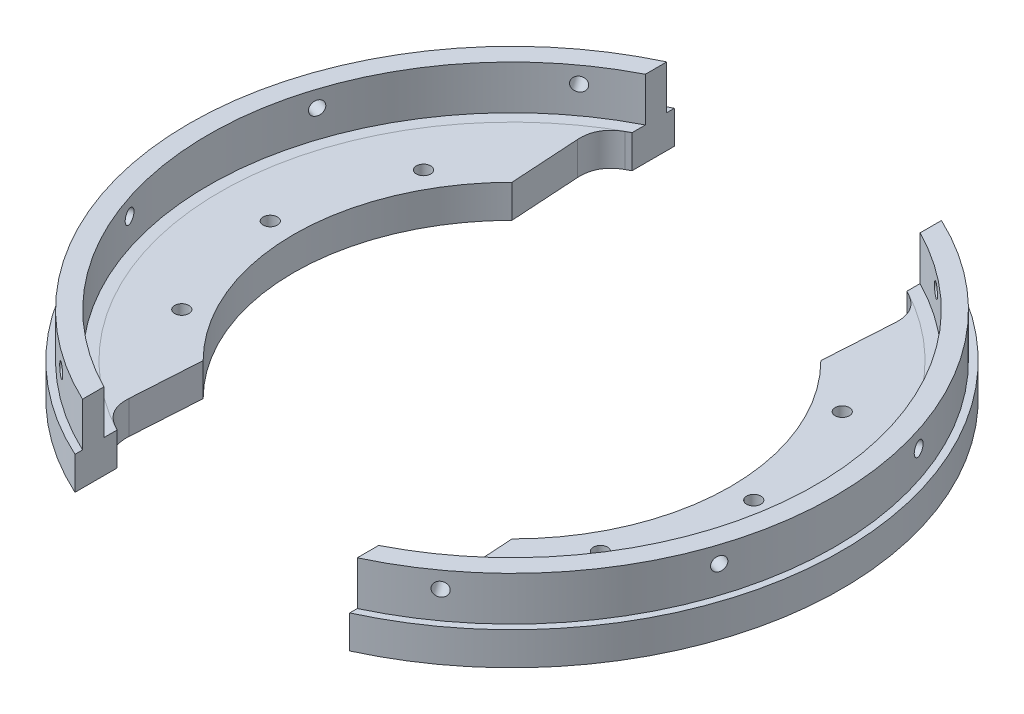
from build123d import *

# Parameters (mm, degrees)
SKETCH1_R               = 152.4
SKETCH1_R_2             = 100.965
BOSS_EXTRUDE1_DEPTH     = 15.24
SKETCH4_R               = 149.225
SKETCH4_R_2             = 140.335
BOSS_EXTRUDE3_DEPTH     = 20.32
CUT_EXTRUDE5_DEPTH      = 15.24
CIRPATTERN1_COUNT       = 2
SKETCH31_R              = 3.302
CUT_EXTRUDE6_DEPTH      = 217.481921647
CIRPATTERN2_COUNT       = 12
CUT_EXTRUDE7_REACH      = 341.806
CUT_EXTRUDE7_END_RADIUS = 140.335
SKETCH34_R              = 3.175
CIRPATTERN3_COUNT       = 10
SKETCH37_W              = 127
SKETCH37_H              = 40.478806784
CUT_EXTRUDE8_DEPTH      = 343.627076715


with BuildPart() as part:
    # Sketch1 → Boss-Extrude1 (new body)
    with BuildSketch(Plane(origin=(0, 0, 0), x_dir=(1, 0, 0), z_dir=(0, 1, 0))):
        with Locations(Location((0, 0, 0), (0, 0, 90))):
            Circle(SKETCH1_R)
        with Locations(Location((0, 0, 0), (0, 0, 90))):
            Circle(SKETCH1_R_2, mode=Mode.SUBTRACT)
    extrude(amount=BOSS_EXTRUDE1_DEPTH)

    # Sketch4 → Boss-Extrude3 (add)
    with BuildSketch(Plane(origin=(0, 15.24, 0), x_dir=(1, 0, 0), z_dir=(0, 1, 0))):
        with Locations(Location((0, 0, 0), (0, 0, 270))):
            Circle(SKETCH4_R)
        with Locations(Location((0, 0, 0), (0, 0, 270))):
            Circle(SKETCH4_R_2, mode=Mode.SUBTRACT)
    extrude(amount=BOSS_EXTRUDE3_DEPTH)

    # Sketch27 → Cut-Extrude5 (cut)
    with BuildSketch(Plane(origin=(0, 0, 0), x_dir=(1, 0, 0), z_dir=(0, 1, 0))):
        with BuildLine():
            ThreePointArc((-71.393036162, 71.393036162), (0, 100.965), (71.393036162, 71.393036162))
            Line((71.393036162, 71.393036162), (73.941810795, 112.804753064))
            ThreePointArc((73.941810795, 112.804753064), (0, 134.878848221), (-73.941810795, 112.804753064))
            Line((-73.941810795, 112.804753064), (-71.393036162, 71.393036162))
        make_face()
    cut_extrude5 = extrude(amount=CUT_EXTRUDE5_DEPTH, mode=Mode.SUBTRACT)

    # CirPattern1: Cut-Extrude5 ×2 about axis
    cirpattern1_axis = Axis((0, 0, 0), (0, 1, 0))
    for i in range(1, CIRPATTERN1_COUNT):
        add(cut_extrude5.rotate(cirpattern1_axis, i * 360 / CIRPATTERN1_COUNT), mode=Mode.SUBTRACT)

    # Sketch31 → Cut-Extrude6 (cut, through all)
    with BuildSketch(Plane(origin=(0, 15.24, 0), x_dir=(1, 0, 0), z_dir=(0, 1, 0))):
        with Locations(Location((-111.76, 0, 0), (0, 0, 270))):
            Circle(SKETCH31_R)
    cut_extrude6 = extrude(amount=-CUT_EXTRUDE6_DEPTH, mode=Mode.SUBTRACT)

    # CirPattern2: Cut-Extrude6 ×12 about axis
    cirpattern2_axis = Axis((0, 0, 0), (0, 1, 0))
    for i in range(1, CIRPATTERN2_COUNT):
        add(cut_extrude6.rotate(cirpattern2_axis, i * 360 / CIRPATTERN2_COUNT), mode=Mode.SUBTRACT)

    # Cut-Extrude7: up to this cylinder (the profile starts outside it)
    cut_extrude7_end = Plane(origin=(0, 27.94, 0), z_dir=(0, -1, 0)) * Cylinder(CUT_EXTRUDE7_END_RADIUS, 965.282, mode=Mode.PRIVATE)
    # Sketch34 → Cut-Extrude7 (cut, up to the surface)
    with BuildSketch(Plane(origin=(0, 0, -149.225), x_dir=(-1, 0, 0), z_dir=(0, 0, -1)), mode=Mode.PRIVATE) as cut_extrude7_sk1:
        with Locations((0, 27.94)):
            Circle(SKETCH34_R)
    cut_extrude7_tool1 = extrude(cut_extrude7_sk1.sketch, amount=-CUT_EXTRUDE7_REACH, mode=Mode.PRIVATE) - cut_extrude7_end
    cut_extrude7 = cut_extrude7_tool1.solids().sort_by_distance((0, 27.94, -149.225))[0]
    add(cut_extrude7, mode=Mode.SUBTRACT)

    # CirPattern3: Cut-Extrude7 ×10 about axis
    cirpattern3_axis = Axis((0, 37.338, 0), (0, -1, 0))
    for i in range(1, CIRPATTERN3_COUNT):
        add(cut_extrude7.rotate(cirpattern3_axis, i * 360 / CIRPATTERN3_COUNT), mode=Mode.SUBTRACT)

    # Fillet8
    # a fillet whose section is not a circle: 15.24 mm, written as the material it adds along each edge
    with BuildSketch(Plane(origin=(-73.941810795, 0, -112.804753064), x_dir=(0.8556652721365351, 0, -0.5175296533141934), z_dir=(0, 1, 0))) as fillet8_piece_1:
        with BuildLine():
            Bezier((9.779269822, 0), (0.182347878, 0.348136944), (-4.273436554, -8.158806998), weights=[1, 1, 1])
            Line((-4.273436554, -8.158806998), (0, 0))
            ThreePointArc((0, 0), (4.889634911, 0.088658786), (9.779269822, 0))
        make_face()
    extrude(amount=15.24)
    with BuildSketch(Plane(origin=(-73.941810795, 0, 112.804753064), x_dir=(0.8556652721365348, 0, 0.5175296533141941), z_dir=(0, 1, 0))) as fillet8_piece_2:
        with BuildLine():
            Bezier((9.779269822, 0), (0.182347878, -0.348136944), (-4.273436554, 8.158806998), weights=[1, 1, 1])
            Line((-4.273436554, 8.158806998), (0, 0))
            ThreePointArc((0, 0), (4.889634911, -0.088658786), (9.779269822, 0))
        make_face()
    extrude(amount=15.24)
    with BuildSketch(Plane(origin=(73.941810795, 0, 112.804753064), x_dir=(-0.061430943800239474, 0, -0.9981113360461406), z_dir=(0, 1, 0))) as fillet8_piece_3:
        with BuildLine():
            Bezier((9.210232984, 0), (-0.393001374, 0), (-4.537462755, 8.662883468), weights=[1, 1, 1])
            ThreePointArc((-4.537462755, 8.662883468), (-2.347269014, 4.290305131), (0, 0))
            Line((0, 0), (9.210232984, 0))
        make_face()
    extrude(amount=15.24)
    with BuildSketch(Plane(origin=(73.941810795, 0, -112.804753064), x_dir=(-0.061430943800239474, 0, 0.9981113360461406), z_dir=(0, 1, 0))) as fillet8_piece_4:
        with BuildLine():
            Bezier((9.210232984, 0), (-0.393001374, 0), (-4.537462755, -8.662883468), weights=[1, 1, 1])
            ThreePointArc((-4.537462755, -8.662883468), (-2.347269014, -4.290305131), (0, 0))
            Line((0, 0), (9.210232984, 0))
        make_face()
    extrude(amount=15.24)

    # Sketch37 → Cut-Extrude8 (cut, through all)
    with BuildSketch(Plane.XY.offset(152.4)):
        with Locations((0, 20.239403392)):
            Rectangle(SKETCH37_W, SKETCH37_H)
    extrude(amount=-CUT_EXTRUDE8_DEPTH, mode=Mode.SUBTRACT)


with BuildPart() as cut_extrude8_piece_1:
    # of the separate pieces the step leaves, piece 1, a body of its own (cut_extrude8_pieces)
    add(part.part.solids().sort_by_distance((-63.5, 0, -118.996023872))[0])


with BuildPart() as cut_extrude8_piece_2:
    # of the separate pieces the step leaves, piece 2, a body of its own (cut_extrude8_pieces)
    add(part.part.solids().sort_by_distance((73.37601749, 0, -103.611915115))[0])


solid = Compound([cut_extrude8_piece_1.part, cut_extrude8_piece_2.part])
